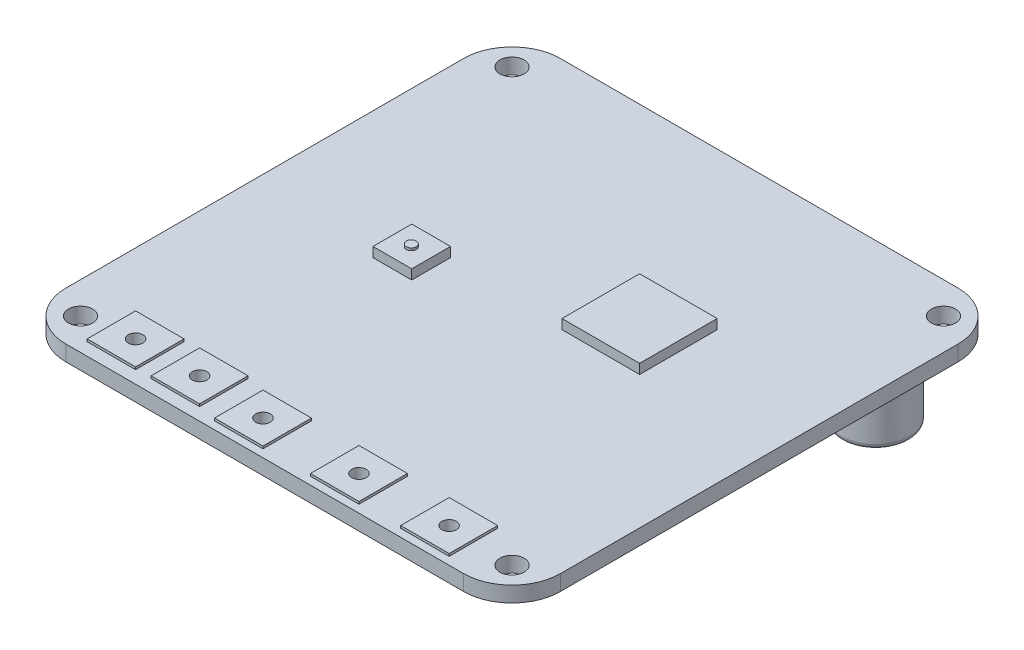
from build123d import *

# Parameters (mm, degrees)
CROQUIS1_W              = 51
CROQUIS1_H              = 51
SALIENTE_EXTRUIR1_DEPTH = 1.6
REDONDEO1_R             = 5
CROQUIS2_W              = 4
CROQUIS2_H              = 4
CROQUIS2_W_2            = 8
CROQUIS2_H_2            = 8
SALIENTE_EXTRUIR2_DEPTH = 1
CROQUIS3_R              = 1.25
CORTAR_EXTRUIR1_DEPTH   = 37.097922378
CROQUIS4_W              = 5
CROQUIS4_H              = 5
SALIENTE_EXTRUIR3_DEPTH = 0.25
CROQUIS5_R              = 0.75
CORTAR_EXTRUIR2_DEPTH   = 37.109867073
CROQUIS6_R              = 3.5
SALIENTE_EXTRUIR4_DEPTH = 12
REDONDEO2_R             = 0.5
CROQUIS7_W              = 38.1
CROQUIS7_H              = 2.54
SALIENTE_EXTRUIR5_DEPTH = 8
CROQUIS8_R              = 0.512123022
SALIENTE_EXTRUIR6_DEPTH = 0.25


with BuildPart() as part:
    # Croquis1 → Saliente-Extruir1 (new body)
    with BuildSketch(Plane(origin=(0, 0, 0), x_dir=(1, 0, 0), z_dir=(0, 1, 0))):
        Rectangle(CROQUIS1_W, CROQUIS1_H)
    extrude(amount=-SALIENTE_EXTRUIR1_DEPTH)

    # Redondeo1
    redondeo1_edges = [part.edges().sort_by_distance(p)[0] for p in [
        (25.5, -0.8, -25.5),
        (-25.5, -0.8, -25.5),
        (-25.5, -0.8, 25.5),
        (25.5, -0.8, 25.5),
    ]]
    fillet(redondeo1_edges, radius=REDONDEO1_R)

    # Croquis2 → Saliente-Extruir2 (add)
    with BuildSketch(Plane(origin=(0, 0, 0), x_dir=(1, 0, 0), z_dir=(0, 1, 0))):
        with Locations((-10.387074195, 0.047356258)):
            Rectangle(CROQUIS2_W, CROQUIS2_H)
        with Locations((7.8, 5.359014033)):
            Rectangle(CROQUIS2_W_2, CROQUIS2_H_2)
    extrude(amount=SALIENTE_EXTRUIR2_DEPTH)

    # Croquis3 → Cortar-Extruir1 (cut, through all)
    with BuildSketch(Plane(origin=(0, 0, 0), x_dir=(1, 0, 0), z_dir=(0, 1, 0))):
        with Locations((-22.25, 22.25)):
            Circle(CROQUIS3_R)
        with Locations((-22.25, -22.25)):
            Circle(CROQUIS3_R)
        with Locations((22.25, -22.25)):
            Circle(CROQUIS3_R)
        with Locations((22.25, 22.25)):
            Circle(CROQUIS3_R)
    extrude(amount=-CORTAR_EXTRUIR1_DEPTH, mode=Mode.SUBTRACT)

    # Croquis4 → Saliente-Extruir3 (add)
    with BuildSketch(Plane(origin=(0, 0, 0), x_dir=(1, 0, 0), z_dir=(0, 1, 0))):
        with Locations((-3.48, -22.2)):
            Rectangle(CROQUIS4_W, CROQUIS4_H)
        with Locations((6.42, -22.2)):
            Rectangle(CROQUIS4_W, CROQUIS4_H)
        with Locations((15.72, -22.2)):
            Rectangle(CROQUIS4_W, CROQUIS4_H)
        with Locations((-10.52, -21.7)):
            Rectangle(CROQUIS4_W, CROQUIS4_H)
        with Locations((-17.12, -21.7)):
            Rectangle(CROQUIS4_W, CROQUIS4_H)
    extrude(amount=SALIENTE_EXTRUIR3_DEPTH)

    # Croquis5 → Cortar-Extruir2 (cut, through all)
    with BuildSketch(Plane(origin=(0, 0.25, 0), x_dir=(1, 0, 0), z_dir=(0, 1, 0))):
        with Locations((-3.48, -22.2)):
            Circle(CROQUIS5_R)
        with Locations((6.42, -22.2)):
            Circle(CROQUIS5_R)
        with Locations((15.72, -22.2)):
            Circle(CROQUIS5_R)
        with Locations((-10.52, -21.7)):
            Circle(CROQUIS5_R)
        with Locations((-17.12, -21.7)):
            Circle(CROQUIS5_R)
    extrude(amount=-CORTAR_EXTRUIR2_DEPTH, mode=Mode.SUBTRACT)

    # Croquis6 → Saliente-Extruir4 (add)
    with BuildSketch(Plane(origin=(0, -1.6, 0), x_dir=(1, 0, 0), z_dir=(0, 1, 0))):
        with Locations((-15.2, 22.84)):
            Circle(CROQUIS6_R)
        with Locations((14.65, 22.84)):
            Circle(CROQUIS6_R)
    extrude(amount=-SALIENTE_EXTRUIR4_DEPTH)

    # Redondeo2
    redondeo2_edges = [part.edges().sort_by_distance(p)[0] for p in [
        (11.15, -13.6, -22.84),
        (-18.7, -13.6, -22.84),
    ]]
    fillet(redondeo2_edges, radius=REDONDEO2_R)

    # Croquis7 → Saliente-Extruir5 (add)
    with BuildSketch(Plane.XZ.offset(1.6)):
        with Locations((-3.45, -17.29)):
            Rectangle(CROQUIS7_W, CROQUIS7_H)
        with Locations((-3.45, 8.06)):
            Rectangle(CROQUIS7_W, CROQUIS7_H)
    extrude(amount=SALIENTE_EXTRUIR5_DEPTH)

    # Croquis8 → Saliente-Extruir6 (add)
    with BuildSketch(Plane(origin=(0, 1, 0), x_dir=(1, 0, 0), z_dir=(0, 1, 0))):
        with Locations((-10.387074195, 0)):
            Circle(CROQUIS8_R)
    extrude(amount=SALIENTE_EXTRUIR6_DEPTH)


solid = part.part
